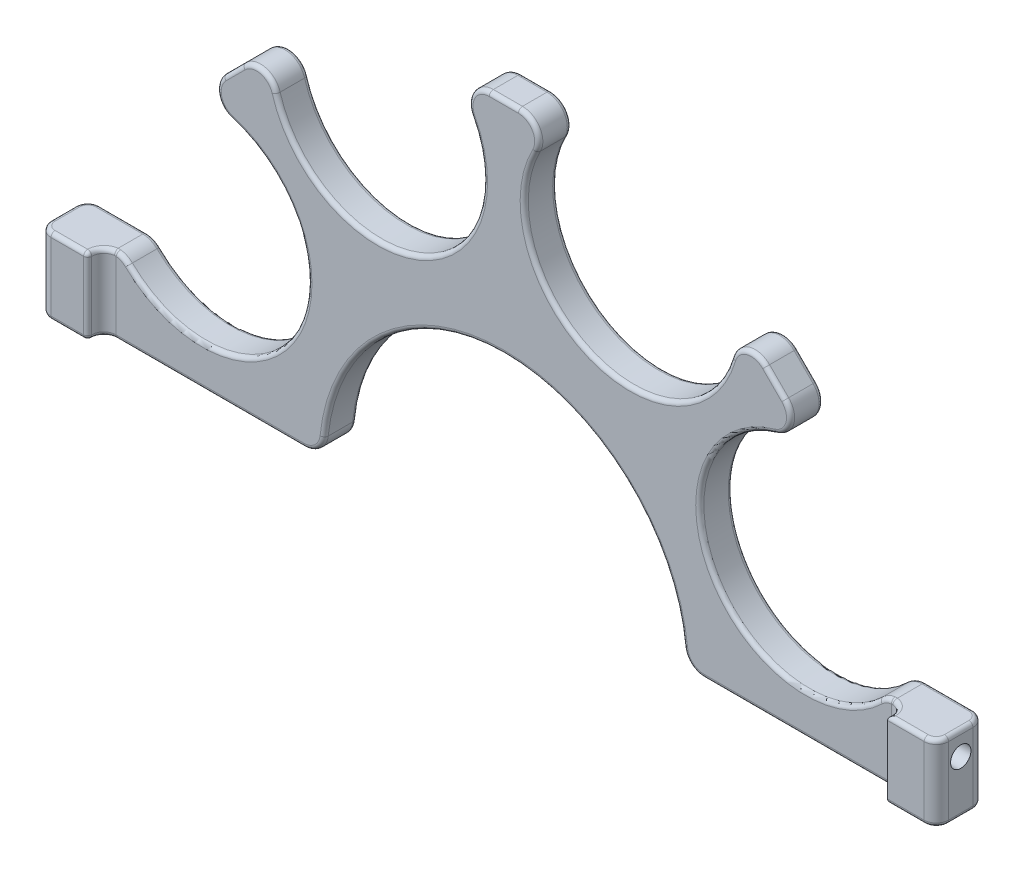
from build123d import *

# Parameters (mm, degrees)
BOSS_EXTRUDE1_DEPTH = 4
SKETCH4_W           = 12
SKETCH4_H           = 18.69043342
BOSS_EXTRUDE2_DEPTH = 4
SKETCH5_R           = 2.5
CUT_EXTRUDE1_DEPTH  = 8
SKETCH6_R           = 2.5
CUT_EXTRUDE2_DEPTH  = 10
FILLET2_R           = 5
FILLET3_R           = 3
FILLET4_R           = 1


with BuildPart() as part:
    # Sketch3 → Boss-Extrude1 (new, symmetric)
    with BuildSketch(Plane.XY):
        with BuildLine():
            Line((-13.757190246, 41.026600397), (13.757190246, 41.026600397))
            ThreePointArc((13.757190246, 41.026600397), (21.35621817, -2.57858376), (56.904485258, 23.793333459))
            Line((56.904485258, 23.793333459), (76.360090285, 4.337728432))
            ThreePointArc((76.360090285, 4.337728432), (49.988173066, -31.210538656), (93.593357223, -38.80956658))
            Line((93.593357223, -38.80956658), (110.25, -38.80956658))
            Line((110.25, -38.80956658), (110.25, -57.5))
            Line((110.25, -57.5), (44.38310392, -57.5))
            ThreePointArc((44.38310392, -57.5), (0, -13.11689608), (-44.38310392, -57.5))
            Line((-44.38310392, -57.5), (-110.25, -57.5))
            Line((-110.25, -57.5), (-110.25, -38.80956658))
            Line((-110.25, -38.80956658), (-93.593357223, -38.80956658))
            ThreePointArc((-93.593357223, -38.80956658), (-49.988173066, -31.210538656), (-76.360090285, 4.337728432))
            Line((-76.360090285, 4.337728432), (-56.904485258, 23.793333459))
            ThreePointArc((-56.904485258, 23.793333459), (-21.35621817, -2.57858376), (-13.757190246, 41.026600397))
        make_face()
    extrude(amount=BOSS_EXTRUDE1_DEPTH, both=True)

    # Sketch4 → Boss-Extrude2 (add)
    with BuildSketch(Plane.XY.offset(4)):
        with Locations((-104.25, -48.15478329)):
            Rectangle(SKETCH4_W, SKETCH4_H)
    boss_extrude2 = extrude(amount=BOSS_EXTRUDE2_DEPTH)

    # Sketch5 → Cut-Extrude1 (cut)
    with BuildSketch(Plane(origin=(0, -57.5, 0), x_dir=(-1, 0, 0), z_dir=(0, -1, 0))):
        with Locations(Location((104.25, -2, 0), (0, 0, 180))):
            Circle(SKETCH5_R)
    cut_extrude1 = extrude(amount=-CUT_EXTRUDE1_DEPTH, mode=Mode.SUBTRACT)

    # Sketch6 → Cut-Extrude2 (cut)
    with BuildSketch(Plane.ZY.offset(110.25)):
        with Locations((2, -44.5)):
            Circle(SKETCH6_R)
    cut_extrude2 = extrude(amount=-CUT_EXTRUDE2_DEPTH, mode=Mode.SUBTRACT)

    # Mirror1: Boss-Extrude2, Cut-Extrude1, Cut-Extrude2 across plane
    add(boss_extrude2.mirror(Plane(origin=(0, 0, 0), x_dir=(0, 0, 1), z_dir=(1, 0, 0))))
    add(cut_extrude1.mirror(Plane(origin=(0, 0, 0), x_dir=(0, 0, 1), z_dir=(1, 0, 0))), mode=Mode.SUBTRACT)
    add(cut_extrude2.mirror(Plane(origin=(0, 0, 0), x_dir=(0, 0, 1), z_dir=(1, 0, 0))), mode=Mode.SUBTRACT)

    # Fillet2
    fillet2_edges = [part.edges().sort_by_distance(p)[0] for p in [
        (-44.38310392, -57.5, 0),
        (-93.593357223, -38.80956658, 0),
        (-76.360090285, 4.337728432, 0),
        (-56.904485258, 23.793333459, 0),
        (-13.757190246, 41.026600397, 0),
        (13.757190246, 41.026600397, 0),
        (56.904485258, 23.793333459, 0),
        (76.360090285, 4.337728432, 0),
        (93.593357223, -38.80956658, 0),
        (44.38310392, -57.5, 0),
    ]]
    fillet(fillet2_edges, radius=FILLET2_R)

    # Fillet3
    fillet3_edges = [part.edges().sort_by_distance(p)[0] for p in [
        (-110.25, -48.15478329, -4),
        (-110.25, -48.15478329, 8),
        (110.25, -48.15478329, 8),
        (110.25, -48.15478329, -4),
        (98.25, -48.15478329, 4),
        (-98.25, -48.15478329, 4),
    ]]
    fillet(fillet3_edges, radius=FILLET3_R)

    # Fillet4
    fillet4_edges = [part.edges().sort_by_distance(p)[0] for p in [
        (-102.75, -57.5, 8),
        (102.75, -57.5, 8),
        (109.371320344, -57.5, 7.121320344),
        (110.25, -57.5, 2),
        (109.371320344, -57.5, -3.121320344),
        (78.189664422, -57.5, -4),
        (45.777555442, -56.21020418, -4),
        (0, -13.11689608, -4),
        (-45.777555442, -56.21020418, -4),
        (-78.189664422, -57.5, -4),
        (-109.371320344, -57.5, -3.121320344),
        (-110.25, -57.5, 2),
        (98.25, -57.5, 7.5),
        (97.371320344, -57.5, 4.878679656),
        (72.189664422, -57.5, 4),
        (45.777555442, -56.21020418, 4),
        (0, -13.11689608, 4),
        (-45.777555442, -56.21020418, 4),
        (-72.189664422, -57.5, 4),
        (98.25, -38.80956658, 7.5),
        (97.53358541, -38.80956658, 5.054431272),
        (93.628479419, -39.27103431, 4),
        (51.667019738, -34.653263281, 4),
        (70.281919711, 6.949077724, 4),
        (66.632287772, 14.065530945, 4),
        (59.51583455, 17.715162885, 4),
        (21.240477683, -2.532034101, 4),
        (7.860392218, 38.609122016, 4),
        (0, 41.026600397, 4),
        (-7.860392218, 38.609122016, 4),
        (-21.240477683, -2.532034101, 4),
        (-59.51583455, 17.715162885, 4),
        (-66.632287772, 14.065530945, 4),
        (-70.281919711, 6.949077724, 4),
        (-51.667019738, -34.653263281, 4),
        (-93.628479419, -39.27103431, 4),
        (102.75, -38.80956658, 8),
        (109.371320344, -38.80956658, 7.121320344),
        (110.25, -38.80956658, 2),
        (109.371320344, -38.80956658, -3.121320344),
        (101.488254108, -38.80956658, -4),
        (93.847379403, -39.176114853, -4),
        (51.667019738, -34.653263281, -4),
        (70.281919711, 6.949077724, -4),
        (66.632287772, 14.065530945, -4),
        (59.51583455, 17.715162885, -4),
        (21.240477683, -2.532034101, -4),
        (7.860392218, 38.609122016, -4),
        (0, 41.026600397, -4),
        (-7.860392218, 38.609122016, -4),
        (-21.240477683, -2.532034101, -4),
        (-59.51583455, 17.715162885, -4),
        (-66.632287772, 14.065530945, -4),
        (-70.281919711, 6.949077724, -4),
        (-51.667019738, -34.653263281, -4),
        (-93.847379403, -39.176114853, -4),
        (-101.488254108, -38.80956658, -4),
        (-109.371320344, -38.80956658, -3.121320344),
        (-110.25, -38.80956658, 2),
        (-109.371320344, -38.80956658, 7.121320344),
        (-109.371320344, -57.5, 7.121320344),
        (-97.371320344, -57.5, 4.878679656),
        (-97.53358541, -38.80956658, 5.054431272),
        (-102.75, -38.80956658, 8),
        (-98.25, -48.15478329, 8),
        (95.48918045, -38.815202204, 4.009549779),
        (-95.489157981, -38.815203301, 4.009547981),
    ]]
    fillet(fillet4_edges, radius=FILLET4_R - 0.0001)  # a hair under: the kernel refuses the full size


solid = part.part
